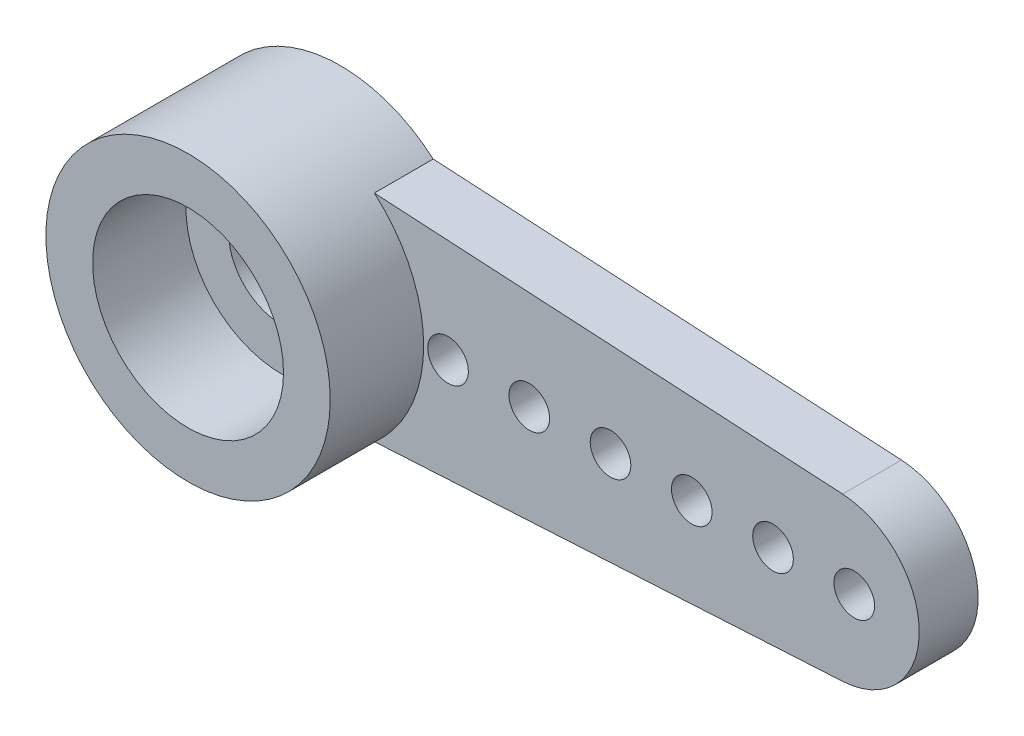
from build123d import *

# Parameters (mm, degrees)
EXTRUDE_1_DEPTH        = 1.45
SKETCH_2_R             = 3.5
SKETCH_2_R_2           = 2.35
EXTRUDE_2_DEPTH        = 2.3
SKETCH_3_R             = 2.3
CUT_EXTRUDE_1_DEPTH    = 0.7
SKETCH_4_R             = 1.3
CUT_EXTRUDE_2_DEPTH    = 17.372003543
SKETCH_5_R             = 0.5
CUT_EXTRUDE_3_DEPTH    = 17.516733939
PATTERN_LINEAR_1_COUNT = 6
PATTERN_LINEAR_1_PITCH = 2


with BuildPart() as part:
    # 草图1 → 凸台-拉伸1 (new body)
    with BuildSketch(Plane.XY):
        with BuildLine():
            ThreePointArc((2.286372673, 2.65), (-3.5, 0), (2.286372673, -2.65))
            Line((2.286372673, -2.65), (13.813155123, -1.996796414))
            ThreePointArc((13.813155123, -1.996796414), (15.7, -8e-09), (13.813155138, 1.996796413))
            Line((13.813155138, 1.996796413), (2.286372673, 2.65))
        make_face()
    extrude(amount=EXTRUDE_1_DEPTH)

    # 草图2 → 凸台-拉伸2 (add)
    with BuildSketch(Plane.XY.offset(1.45)):
        Circle(SKETCH_2_R)
        Circle(SKETCH_2_R_2, mode=Mode.SUBTRACT)
    extrude(amount=EXTRUDE_2_DEPTH)

    # 草图3 → 切除-拉伸1 (cut)
    with BuildSketch(Plane(origin=(0, 0, 0), x_dir=(-1, 0, 0), z_dir=(0, 0, -1))):
        Circle(SKETCH_3_R)
    extrude(amount=-CUT_EXTRUDE_1_DEPTH, mode=Mode.SUBTRACT)

    # 草图4 → 切除-拉伸2 (cut, through all)
    with BuildSketch(Plane(origin=(0, 0, 0.7), x_dir=(-1, 0, 0), z_dir=(0, 0, -1))):
        Circle(SKETCH_4_R)
    extrude(amount=-CUT_EXTRUDE_2_DEPTH, mode=Mode.SUBTRACT)

    # 草图5 → 切除-拉伸3 (cut, through all)
    with BuildSketch(Plane(origin=(0, 0, 0), x_dir=(-1, 0, 0), z_dir=(0, 0, -1))):
        with Locations((-14.1, 0)):
            Circle(SKETCH_5_R)
    cut_extrude_3 = extrude(amount=-CUT_EXTRUDE_3_DEPTH, mode=Mode.SUBTRACT)

    # 阵列(线性)1: 切除-拉伸3 ×6
    with Locations(*[(-i * PATTERN_LINEAR_1_PITCH, 0, 0) for i in range(1, PATTERN_LINEAR_1_COUNT)]):
        add(cut_extrude_3, mode=Mode.SUBTRACT)


solid = part.part
